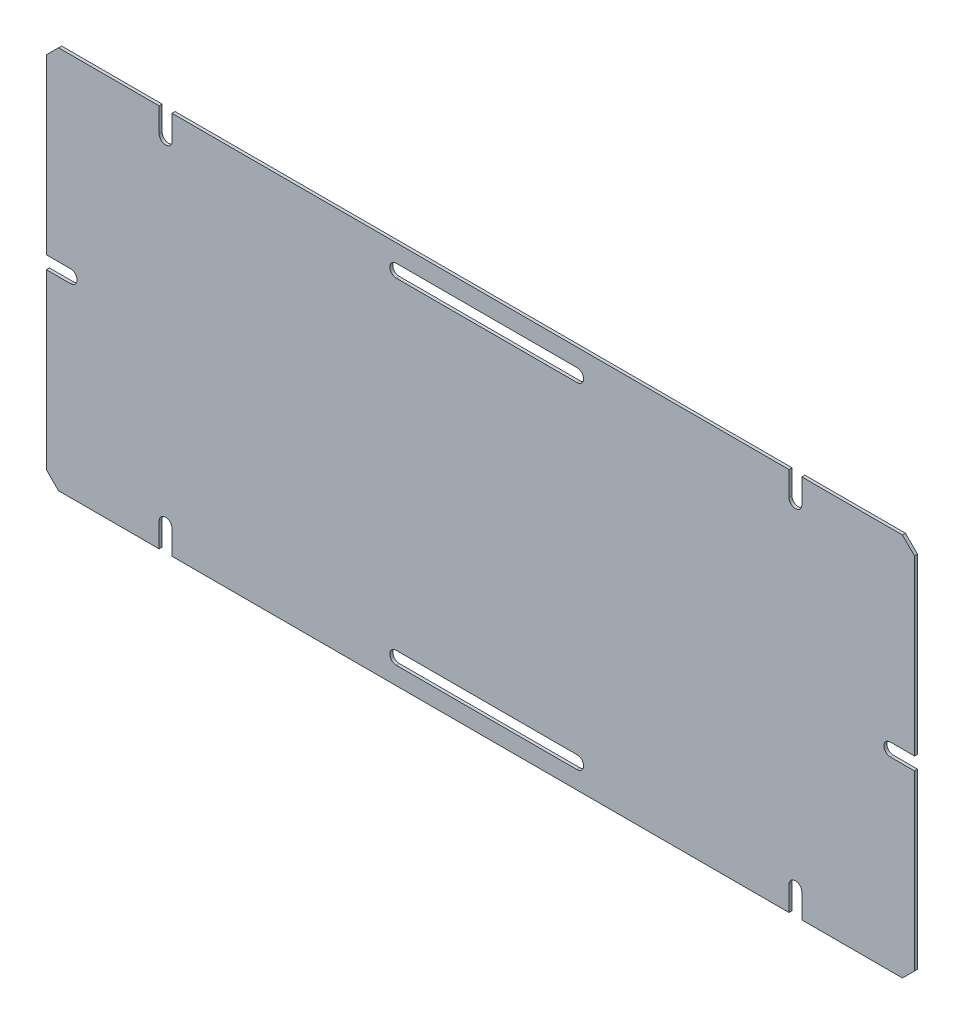
from build123d import *

# Parameters (mm, degrees)
SKETCH1_W                   = 455.168
SKETCH1_H                   = 201.168
BOSS_EXTRUDE1_DEPTH         = 1.5875
F_1_4_CLEARANCE_HOLE1_D     = 6.7564
F_1_4_CLEARANCE_SLOT1_DEPTH = 1.5875
CHAMFER1_SIZE               = 6.35
CUT_EXTRUDE1_REACH          = 250.826
SKETCH6_W                   = 6.7564
SKETCH6_H                   = 14.478
CUT_EXTRUDE2_REACH          = 250.826
SKETCH7_W                   = 14.478
SKETCH7_H                   = 6.7564


# Read off the part's stored shape, not the designer's step: 1/4 Clearance Slot1
with BuildPart() as part:
    # Sketch1 → Boss-Extrude1 (new body)
    with BuildSketch(Plane.XY):
        Rectangle(SKETCH1_W, SKETCH1_H)
    extrude(amount=BOSS_EXTRUDE1_DEPTH)

    # 1/4 Clearance Hole1 (through all)
    with Locations(Plane.XY.offset(1.5875)):
        with Locations((-165.1, 87.884), (165.1, 87.884), (214.884, 0), (-214.884, 0), (-165.1, -87.884), (165.1, -87.884)):
            Hole(F_1_4_CLEARANCE_HOLE1_D / 2)

    # 1/4 Clearance Slot1 outline → 1/4 Clearance Slot1 (cut)
    with BuildSketch(Plane.XY):
        with BuildLine():
            Line((-44.1706, 84.5058), (50.673, 84.5058))
            ThreePointArc((50.673, 84.5058), (54.0512, 87.884), (50.673, 91.2622))
            Line((50.673, 91.2622), (-44.1706, 91.2622))
            ThreePointArc((-44.1706, 91.2622), (-47.5488, 87.884), (-44.1706, 84.5058))
        make_face()
        with BuildLine():
            Line((-44.1706, -91.2622), (50.673, -91.2622))
            ThreePointArc((50.673, -91.2622), (54.0512, -87.884), (50.673, -84.5058))
            Line((50.673, -84.5058), (-44.1706, -84.5058))
            ThreePointArc((-44.1706, -84.5058), (-47.5488, -87.884), (-44.1706, -91.2622))
        make_face()
    extrude(amount=F_1_4_CLEARANCE_SLOT1_DEPTH, mode=Mode.SUBTRACT)

    # Chamfer1
    chamfer1_edges = [part.edges().sort_by_distance(p)[0] for p in [
        (227.584, -100.584, 0.79375),
        (-227.584, -100.584, 0.79375),
        (-227.584, 100.584, 0.79375),
        (227.584, 100.584, 0.79375),
    ]]
    chamfer(chamfer1_edges, length=CHAMFER1_SIZE)

    # Sketch6 → Cut-Extrude1 (cut, up to next)
    with BuildSketch(Plane.XY.offset(1.5875), mode=Mode.PRIVATE) as cut_extrude1_sk1:
        with Locations((-165.1, 95.123)):
            Rectangle(SKETCH6_W, SKETCH6_H)
    cut_extrude1_tool1 = extrude(cut_extrude1_sk1.sketch, amount=-CUT_EXTRUDE1_REACH, mode=Mode.PRIVATE) & part.part
    # Sketch6 → Cut-Extrude1 (cut, up to next)
    with BuildSketch(Plane.XY.offset(1.5875), mode=Mode.PRIVATE) as cut_extrude1_sk2:
        with Locations((165.1, 95.123)):
            Rectangle(SKETCH6_W, SKETCH6_H)
    cut_extrude1_tool2 = extrude(cut_extrude1_sk2.sketch, amount=-CUT_EXTRUDE1_REACH, mode=Mode.PRIVATE) & part.part
    cut_extrude1_1 = cut_extrude1_tool1.solids().sort_by_distance((-165.1, 95.123, 1.5875))[0]
    add(cut_extrude1_1, mode=Mode.SUBTRACT)
    cut_extrude1_2 = cut_extrude1_tool2.solids().sort_by_distance((165.1, 95.123, 1.5875))[0]
    add(cut_extrude1_2, mode=Mode.SUBTRACT)
    cut_extrude1 = cut_extrude1_1 + cut_extrude1_2  # Cut-Extrude1 as one shape, for the pattern or mirror that repeats it

    # Mirror1: Cut-Extrude1 across plane
    add(cut_extrude1.mirror(Plane.ZX), mode=Mode.SUBTRACT)

    # Sketch7 → Cut-Extrude2 (cut, up to next)
    with BuildSketch(Plane.XY.offset(1.5875), mode=Mode.PRIVATE) as cut_extrude2_sk1:
        with Locations((-222.123, 0)):
            Rectangle(SKETCH7_W, SKETCH7_H)
    cut_extrude2_tool1 = extrude(cut_extrude2_sk1.sketch, amount=-CUT_EXTRUDE2_REACH, mode=Mode.PRIVATE) & part.part
    cut_extrude2 = cut_extrude2_tool1.solids().sort_by_distance((-222.123, 0, 1.5875))[0]
    add(cut_extrude2, mode=Mode.SUBTRACT)

    # Mirror2: Cut-Extrude2 across plane
    add(cut_extrude2.mirror(Plane(origin=(0, 0, 0), x_dir=(0, 0, 1), z_dir=(1, 0, 0))), mode=Mode.SUBTRACT)


solid = part.part
